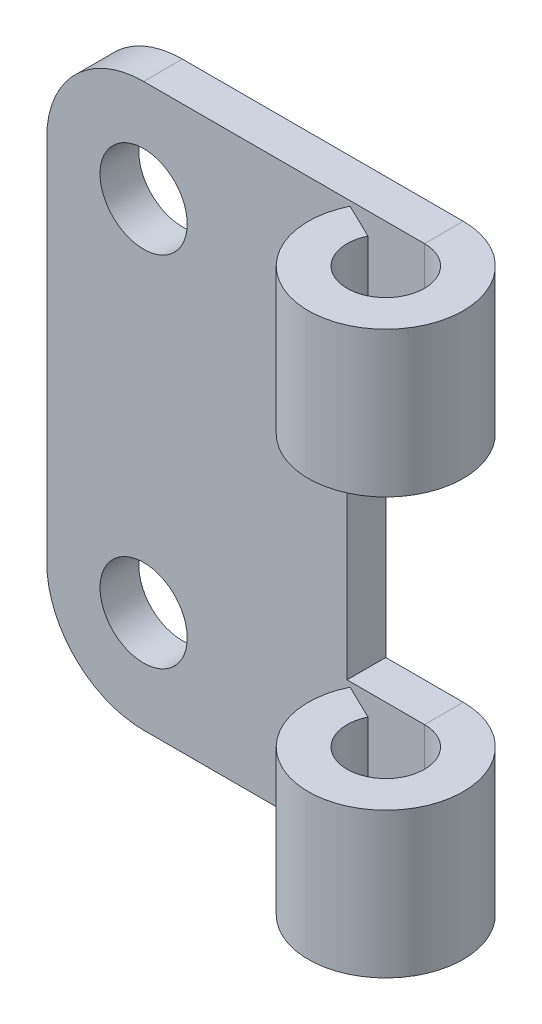
from build123d import *

# Parameters (mm, degrees)
BASE_FLANGE1_DEPTH = 4
HEM2_START         = -29
HEM2_DEPTH         = 15
HEM2_START_2       = 14
HEM2_2_DEPTH       = 15
SKETCH16_R         = 4.5
CUT_EXTRUDE1_DEPTH = 10
FILLET1_R          = 10


# Read off the part's stored shape, not the designer's step: Hem2
# Sheet-metal steps are written as plain solids
with BuildPart() as part:
    # Sketch1 → Base-Flange1 (new body)
    with BuildSketch(Plane.XY):
        Polygon((-19.5, 29), (19.5, 29), (19.5, 14), (11.5, 14), (11.5, -14), (19.5, -14), (19.5, -29), (-19.5, -29), align=None)
    extrude(amount=-BASE_FLANGE1_DEPTH)

    # Hem2 outline → Hem2 (add)
    with BuildSketch(Plane(origin=(0, 0, 0), x_dir=(1, 0, 0), z_dir=(0, 1, 0)).offset(HEM2_START)):
        with BuildLine():
            Line((15.904823815, -2.246515413), (12.30964763, -0.493030826))
            ThreePointArc((12.30964763, -0.493030826), (23.739354115, -10.784384769), (19.5, 4))
            Line((19.5, 4), (19.5, 0))
            ThreePointArc((19.5, 0), (21.619677058, -7.392192385), (15.904823815, -2.246515413))
        make_face()
    extrude(amount=HEM2_DEPTH)

    # Hem2 2 outline → Hem2 2 (add)
    with BuildSketch(Plane(origin=(0, 0, 0), x_dir=(1, 0, 0), z_dir=(0, 1, 0)).offset(HEM2_START_2)):
        with BuildLine():
            Line((15.904823815, -2.246515413), (12.30964763, -0.493030826))
            ThreePointArc((12.30964763, -0.493030826), (23.739354115, -10.784384769), (19.5, 4))
            Line((19.5, 4), (19.5, 0))
            ThreePointArc((19.5, 0), (21.619677058, -7.392192385), (15.904823815, -2.246515413))
        make_face()
    extrude(amount=HEM2_2_DEPTH)

    # Sketch16 → Cut-Extrude1 (cut)
    with BuildSketch(Plane.XY):
        with Locations((-9.5, 18.5)):
            Circle(SKETCH16_R)
        with Locations((-9.5, -18.5)):
            Circle(SKETCH16_R)
    extrude(amount=-CUT_EXTRUDE1_DEPTH, mode=Mode.SUBTRACT)

    # Fillet1
    fillet1_edges = [part.edges().sort_by_distance(p)[0] for p in [
        (-19.5, -29, -2),
        (-19.5, 29, -2),
    ]]
    fillet(fillet1_edges, radius=FILLET1_R)


solid = part.part
